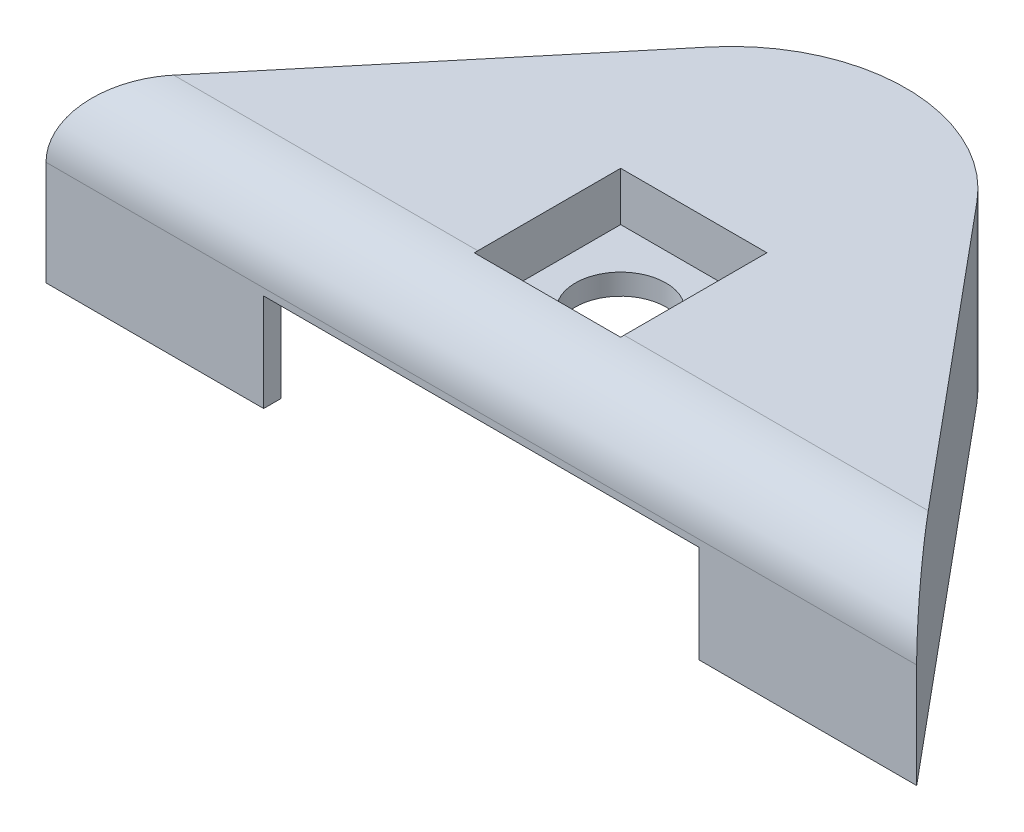
from build123d import *

# Parameters (mm, degrees)
AUFSATZ_LINEAR_AUSTRAGEN1_DEPTH = 50
SKIZZE2_W                       = 125
SKIZZE2_H                       = 28
SCHNITT_LINEAR_AUSTRAGEN1_DEPTH = 30
SCHNITT_LINEAR_AUSTRAGEN2_DEPTH = 30
SKIZZE4_R                       = 13
SCHNITT_LINEAR_AUSTRAGEN3_DEPTH = 30
SKIZZE5_W                       = 42
SKIZZE5_H                       = 42
SCHNITT_LINEAR_AUSTRAGEN4_DEPTH = 14
VERRUNDUNG1_R                   = 20


with BuildPart() as part:
    # Skizze1 → Aufsatz-Linear austragen1 (new body)
    with BuildSketch(Plane(origin=(0, 0, 0), x_dir=(1, 0, 0), z_dir=(0, 1, 0))):
        with BuildLine():
            ThreePointArc((-38.41106398, 28.906723224), (0, 46.897503241), (38.41106398, 28.906723224))
            Line((38.41106398, 28.906723224), (125, -75))
            Line((125, -75), (-125, -75))
            Line((-125, -75), (-38.41106398, 28.906723224))
        make_face()
    extrude(amount=AUFSATZ_LINEAR_AUSTRAGEN1_DEPTH)

    # Skizze2 → Schnitt-Linear austragen1 (cut)
    with BuildSketch(Plane.XY.offset(75)):
        with Locations((0, 14)):
            Rectangle(SKIZZE2_W, SKIZZE2_H)
    extrude(amount=-SCHNITT_LINEAR_AUSTRAGEN1_DEPTH, mode=Mode.SUBTRACT)

    # Skizze3 → Schnitt-Linear austragen2 (cut)
    with BuildSketch(Plane.XZ):
        with BuildLine():
            Line((114.324791937, 70), (-114.324791937, 70))
            Line((-114.324791937, 70), (-34.569957582, -25.705801226))
            ThreePointArc((-34.569957582, -25.705801226), (0, -41.897503241), (34.569957582, -25.705801226))
            Line((34.569957582, -25.705801226), (114.324791937, 70))
        make_face()
    extrude(amount=-SCHNITT_LINEAR_AUSTRAGEN2_DEPTH, mode=Mode.SUBTRACT)

    # Skizze4 → Schnitt-Linear austragen3 (cut)
    with BuildSketch(Plane(origin=(0, 50, 0), x_dir=(1, 0, 0), z_dir=(0, 1, 0))):
        with Locations(Location((0, -35, 0), (0, 0, 270))):
            Circle(SKIZZE4_R)
    extrude(amount=-SCHNITT_LINEAR_AUSTRAGEN3_DEPTH, mode=Mode.SUBTRACT)

    # Skizze5 → Schnitt-Linear austragen4 (cut)
    with BuildSketch(Plane(origin=(0, 50, 0), x_dir=(1, 0, 0), z_dir=(0, 1, 0))):
        with Locations((0, -35)):
            Rectangle(SKIZZE5_W, SKIZZE5_H)
    extrude(amount=-SCHNITT_LINEAR_AUSTRAGEN4_DEPTH, mode=Mode.SUBTRACT)

    # Verrundung1
    # the kernel refuses this fillet: 20 mm, written as the material it takes off along each edge
    with BuildSketch(Plane(origin=(175, 50, 75), x_dir=(0, -1, 0), z_dir=(-1, 0, 0))) as verrundung1_piece_1:
        with BuildLine():
            CenterArc((VERRUNDUNG1_R, -VERRUNDUNG1_R), VERRUNDUNG1_R, 90, 90)
            Line((0, -VERRUNDUNG1_R), (0, 0))
            Line((0, 0), (VERRUNDUNG1_R, 0))
        make_face()
    extrude(amount=350, mode=Mode.SUBTRACT)


solid = part.part
